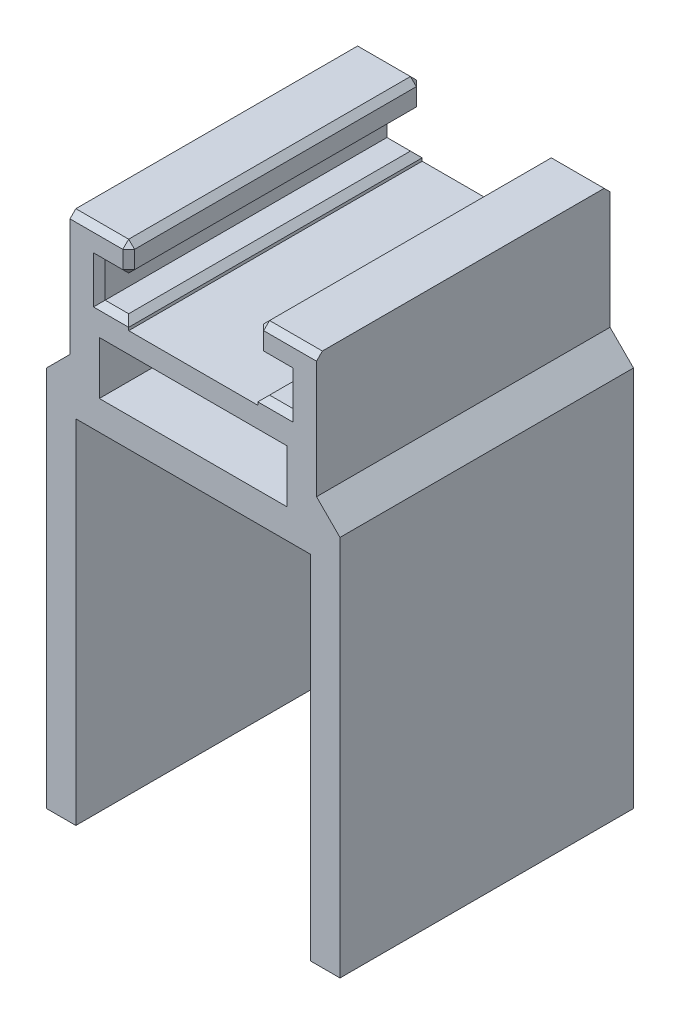
from build123d import *

# Parameters (mm, degrees)
BOSS_EXTRUDE1_DEPTH = 50
CHAMFER2_SIZE       = 1
CHAMFER3_SIZE       = 4


with BuildPart() as part:
    # Sketch1 → Boss-Extrude1 (new body)
    with BuildSketch(Plane.XY):
        Polygon((0, 0), (-20, 0), (-20, -60), (-25, -60), (-25, 5), (-21, 5), (-21, 30), (-11, 30), (-11, 25), (-16, 25), (-16, 19), (-11, 19), (-11, 17.5), (0, 17.5), (0, 14), (-16, 14), (-16, 5), (0, 5), align=None)
    boss_extrude1 = extrude(amount=BOSS_EXTRUDE1_DEPTH)

    # Mirror1: Boss-Extrude1 across plane
    add(boss_extrude1.mirror(Plane(origin=(0, 5, 50), x_dir=(0, 0, 1), z_dir=(-1, 0, 0))))

    # Chamfer2
    chamfer2_edges = [part.edges().sort_by_distance(p)[0] for p in [
        (-16, 30, 0),
        (-11, 27.5, 0),
        (-13.5, 25, 0),
        (-16, 22, 0),
        (-13.5, 19, 0),
        (-11, 30, 25),
        (-11, 25, 25),
        (-11, 19, 25),
        (-13.5, 19, 50),
        (-16, 22, 50),
        (-13.5, 25, 50),
        (-11, 27.5, 50),
        (-16, 30, 50),
        (16, 30, 50),
        (11, 27.5, 50),
        (11, 30, 25),
        (13.5, 25, 50),
        (11, 25, 25),
        (16, 22, 50),
        (13.5, 19, 50),
        (11, 19, 25),
        (13.5, 19, 0),
        (16, 22, 0),
        (13.5, 25, 0),
        (11, 27.5, 0),
        (16, 30, 0),
    ]]
    chamfer(chamfer2_edges, length=CHAMFER2_SIZE)

    # Chamfer3
    chamfer3_edges = [part.edges().sort_by_distance(p)[0] for p in [
        (21, 5, 25),
        (-21, 5, 25),
    ]]
    chamfer(chamfer3_edges, length=CHAMFER3_SIZE - 0.0001)  # a hair under: the kernel refuses the full size


solid = part.part
